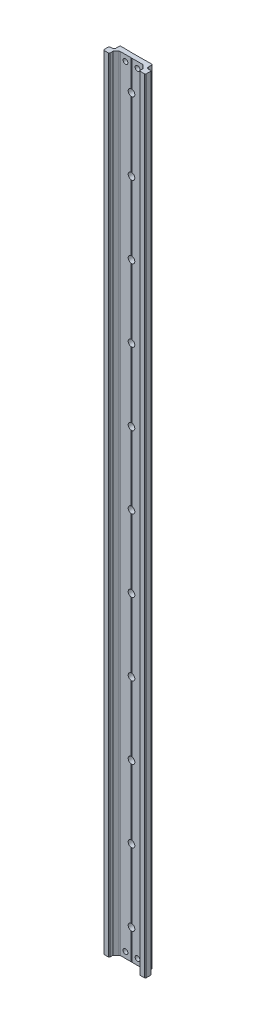
from build123d import *
from OCP.BRepFilletAPI import BRepFilletAPI_MakeChamfer

# Parameters (mm, degrees)
BOSS_EXTRU_1_DEPTH                  = 650
ENL_V_MAT_EXTRU_1_DEPTH             = 651.254758327
ENL_V_MAT_EXTRU_2_DEPTH             = 650
ENL_V_MAT_EXTRU_3_DEPTH             = 651.254758327
ENL_V_MAT_EXTRU_4_DEPTH             = 650
DIAM_TRE_DU_PER_AGE_5_5_5_5_1_D     = 5.5
DIAM_TRE_DU_PER_AGE_5_5_5_5_1_DEPTH = 9.900000103
CHANFREIN1_SIZE                     = 0.5
CHANFREIN1_SIZE2                    = 0.499999975
CHANFREIN2_SIZE                     = 0.3
CHANFREIN3_SIZE                     = 0.499999997
CHANFREIN3_SIZE2                    = 0.500000028
CHANFREIN4_SIZE                     = 0.5
CHANFREIN4_SIZE2                    = 0.500000014
CONG_1_R                            = 1.499999963
CONG_2_R                            = 1.999999944
ESQUISSE8_R                         = 2
ENL_V_MAT_EXTRU_5_DEPTH             = 10


with BuildPart() as part:
    # Esquisse1 → Boss.-Extru.1 (new body)
    with BuildSketch(Plane(origin=(0, 325, 0), x_dir=(1, 0, 0), z_dir=(0, 1, 0))):
        Polygon((-9.70002034, 1.00000045), (9.70002034, 1.00000045), (12.50002072, -1.79999993), (12.50002072, -4.999999928), (17.50002072, -4.999999928), (17.50002072, 5.000000175), (-17.50002072, 5.000000175), (-17.50002072, -4.999999928), (-12.50002072, -4.999999928), (-12.50002072, -1.79999993), align=None)
    extrude(amount=-BOSS_EXTRU_1_DEPTH)

    # Esquisse2 → Enlèv. mat.-Extru.1 (cut, through all)
    with BuildSketch(Plane.XZ.offset(325)):
        Polygon((-14.30002069, -6.7e-08), (-17.50002072, -6.7e-08), (-17.50002072, -5.000000175), (-13.50002072, -5.000000175), (-13.50002072, -0.799999947), align=None)
    extrude(amount=-ENL_V_MAT_EXTRU_1_DEPTH, mode=Mode.SUBTRACT)

    # Esquisse3 → Enlèv. mat.-Extru.2 (cut)
    with BuildSketch(Plane.XZ.offset(325)):
        Polygon((0.25, -1.000000175), (-0.25, -1.000000175), (1e-09, -1.144337743), align=None)
    extrude(amount=-ENL_V_MAT_EXTRU_2_DEPTH, mode=Mode.SUBTRACT)

    # Esquisse4 → Enlèv. mat.-Extru.3 (cut, through all)
    with BuildSketch(Plane.XZ.offset(325)):
        Polygon((13.50002072, -0.799999925), (13.50002072, -5.000000175), (17.50002072, -5.000000175), (17.50002072, 7.5e-08), (14.30002072, 7.5e-08), align=None)
    extrude(amount=-ENL_V_MAT_EXTRU_3_DEPTH, mode=Mode.SUBTRACT)

    # Esquisse5 → Enlèv. mat.-Extru.4 (cut)
    with BuildSketch(Plane.XZ.offset(325)):
        Polygon((-7.50002072, -5.000000175), (7.50002072, -5.000000175), (7.40002072, -4.900000175), (-7.40002072, -4.900000175), align=None)
    extrude(amount=-ENL_V_MAT_EXTRU_4_DEPTH, mode=Mode.SUBTRACT)

    # Diamètre du perçage Ø5.5 (5.5)1
    with Locations(Plane(origin=(0, 0, -4.900000175), x_dir=(-1, 0, 0), z_dir=(0, 0, -1))):
        with Locations((0, 300), (0, 240), (0, 180), (0, 120), (0, 60), (0, 0), (0, -60), (0, -120), (0, -180), (0, -240), (0, -300)):
            Hole(DIAM_TRE_DU_PER_AGE_5_5_5_5_1_D / 2, depth=DIAM_TRE_DU_PER_AGE_5_5_5_5_1_DEPTH)

    # Chanfrein1: one chamfer whose edges measure the first distance from different faces: ONE call of the kernel's chamfer builder (chamfer() names one face for all edges)
    chanfrein1_edges_1 = [part.edges().sort_by_distance(p)[0] for p in [
        (17.50002072, 0, 4.999999928),
    ]]
    chanfrein1_side_1 = [part.faces().sort_by_distance(p)[0] for p in [
        (17.50002072, 0, 2.500000001),
    ]]
    chanfrein1_edges_2 = [part.edges().sort_by_distance(p)[0] for p in [
        (-17.50002072, 0, 4.999999928),
    ]]
    chanfrein1_side_2 = [part.faces().sort_by_distance(p)[0] for p in [
        (-15.00002072, 0, 4.999999928),
    ]]
    chanfrein1 = BRepFilletAPI_MakeChamfer(part.part.solid().wrapped)
    for e in chanfrein1_edges_1:
        chanfrein1.Add(CHANFREIN1_SIZE, CHANFREIN1_SIZE2, e.wrapped, chanfrein1_side_1[0].wrapped)  # the first distance lies on this face
    for e in chanfrein1_edges_2:
        chanfrein1.Add(CHANFREIN1_SIZE, CHANFREIN1_SIZE2, e.wrapped, chanfrein1_side_2[0].wrapped)  # the first distance lies on this face
    add(Compound.cast(chanfrein1.Shape()), mode=Mode.REPLACE)

    # Chanfrein2
    chanfrein2_edges = [part.edges().sort_by_distance(p)[0] for p in [
        (-13.50002072, 0, -5.000000175),
        (13.50002072, 0, -5.000000175),
    ]]
    chamfer(chanfrein2_edges, length=CHANFREIN2_SIZE)

    # Chanfrein3: one chamfer whose edges measure the first distance from different faces: ONE call of the kernel's chamfer builder (chamfer() names one face for all edges)
    chanfrein3_edges_1 = [part.edges().sort_by_distance(p)[0] for p in [
        (12.50002072, 0, 4.999999928),
    ]]
    chanfrein3_side_1 = [part.faces().sort_by_distance(p)[0] for p in [
        (14.750020732, 0, 4.999999928),
    ]]
    chanfrein3_edges_2 = [part.edges().sort_by_distance(p)[0] for p in [
        (-17.50002072, 0, -6.7e-08),
    ]]
    chanfrein3_side_2 = [part.faces().sort_by_distance(p)[0] for p in [
        (-15.900020705, 0, -6.7e-08),
    ]]
    chanfrein3_edges_3 = [part.edges().sort_by_distance(p)[0] for p in [
        (-12.50002072, 0, 4.999999928),
    ]]
    chanfrein3_side_3 = [part.faces().sort_by_distance(p)[0] for p in [
        (-12.50002072, 0, 3.399999929),
    ]]
    chanfrein3 = BRepFilletAPI_MakeChamfer(part.part.solid().wrapped)
    for e in chanfrein3_edges_1:
        chanfrein3.Add(CHANFREIN3_SIZE, CHANFREIN3_SIZE2, e.wrapped, chanfrein3_side_1[0].wrapped)  # the first distance lies on this face
    for e in chanfrein3_edges_2:
        chanfrein3.Add(CHANFREIN3_SIZE, CHANFREIN3_SIZE2, e.wrapped, chanfrein3_side_2[0].wrapped)  # the first distance lies on this face
    for e in chanfrein3_edges_3:
        chanfrein3.Add(CHANFREIN3_SIZE, CHANFREIN3_SIZE2, e.wrapped, chanfrein3_side_3[0].wrapped)  # the first distance lies on this face
    add(Compound.cast(chanfrein3.Shape()), mode=Mode.REPLACE)

    # Chanfrein4
    chanfrein4_edges = [part.edges().sort_by_distance(p)[0] for p in [
        (17.50002072, 0, 7.5e-08),
    ]]
    chanfrein4_side = [part.faces().sort_by_distance(p)[0] for p in [
        (15.90002072, 0, 7.5e-08),
    ]]
    chamfer(chanfrein4_edges, length=CHANFREIN4_SIZE, length2=CHANFREIN4_SIZE2, reference=chanfrein4_side[0])

    # Congé1
    cong_1_edges = [part.edges().sort_by_distance(p)[0] for p in [
        (9.70002034, 0, -1.00000045),
        (-9.70002034, 0, -1.00000045),
    ]]
    fillet(cong_1_edges, radius=CONG_1_R)

    # Congé2
    cong_2_edges = [part.edges().sort_by_distance(p)[0] for p in [
        (13.50002072, 0, -0.799999925),
        (-13.50002072, 0, -0.799999947),
    ]]
    fillet(cong_2_edges, radius=CONG_2_R)

    # Esquisse8 → Enlèv. mat.-Extru.5 (cut)
    with BuildSketch(Plane.XY.offset(-1.00000045)):
        with Locations((-4.999999999, -320)):
            Circle(ESQUISSE8_R)
        with Locations((5.000000001, -320)):
            Circle(ESQUISSE8_R)
        with Locations((-4.999999999, 320)):
            Circle(ESQUISSE8_R)
        with Locations((5.000000001, 320)):
            Circle(ESQUISSE8_R)
    extrude(amount=-ENL_V_MAT_EXTRU_5_DEPTH, mode=Mode.SUBTRACT)


solid = part.part
